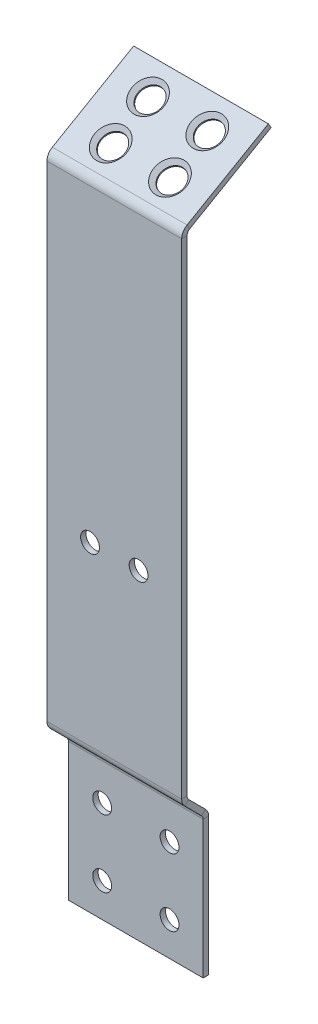
from build123d import *

# Parameters (mm, degrees)
SKETCH_1_W                            = 50
SKETCH_1_H                            = 245
SM_BASE_FLANGE_1_DEPTH                = 2
SM_START                              = -25
SM_EDGE_FLANGE_1_DEPTH                = 50
SM_EDGE_FLANGE_1_2_DEPTH              = 50
OTHER_START                           = -25
OTHER_1_DEPTH                         = 50
OTHER_1_2_DEPTH                       = 50
HOLE_WIZARD_M61_D                     = 9
HOLE_WIZARD_M61_CSINK_D               = 12
HOLE_WIZARD_M61_CSINK_ANGLE           = 90
HOLE_WIZARD_M61_ON_FACE_2_D           = 9
HOLE_WIZARD_M61_ON_FACE_2_CSINK_D     = 12
HOLE_WIZARD_M61_ON_FACE_2_CSINK_ANGLE = 90
HOLE_WIZARD_M61_ON_FACE_3_D           = 9
HOLE_WIZARD_M61_ON_FACE_3_CSINK_D     = 12
HOLE_WIZARD_M61_ON_FACE_3_CSINK_ANGLE = 90
SKETCH_9_R                            = 3.5
CUT_EXTRUDE_1_DEPTH                   = 2
SKETCH_10_R                           = 3.5
CUT_EXTRUDE_2_DEPTH                   = 2


# Read off the part's stored shape, not the designer's step: Ребро-кромка1, Изгиб1
# Sheet-metal steps are written as plain solids
with BuildPart() as part:
    # Sketch 1 → Базовая кромка1 (new body)
    with BuildSketch(Plane.XY):
        with Locations((0, 122.5)):
            Rectangle(SKETCH_1_W, SKETCH_1_H)
    extrude(amount=SM_BASE_FLANGE_1_DEPTH)

    # Ребро-кромка1 outline → Ребро-кромка1 (cut)
    with BuildSketch(Plane.YZ.offset(SM_START)):
        with BuildLine():
            ThreePointArc((241.535898385, 2), (243.535898385, 1.464101615), (245, 0))
            Line((245, 0), (245, 2))
            Line((245, 2), (241.535898385, 2))
        make_face()
    extrude(amount=SM_EDGE_FLANGE_1_DEPTH, mode=Mode.SUBTRACT)

    # Sm Edge Flange 1 2 outline → Sm Edge Flange 1 2 (add)
    with BuildSketch(Plane.YZ.offset(SM_START)):
        with BuildLine():
            Line((262.422649731, -30.176914536), (245, 0))
            Line((245, 0), (241.535898385, 0))
            ThreePointArc((241.535898385, 0), (242.535898385, -0.267949192), (243.267949192, -1))
            Line((243.267949192, -1), (260.690598923, -31.176914536))
            Line((260.690598923, -31.176914536), (262.422649731, -30.176914536))
        make_face()
    extrude(amount=SM_EDGE_FLANGE_1_2_DEPTH)

    # Other 1 outline → Other 1 (cut)
    with BuildSketch(Plane.YZ.offset(OTHER_START)):
        with BuildLine():
            Line((241.535898385, 2), (54.65685425, 2))
            Line((54.65685425, 2), (53.82842715, 1.17157285))
            ThreePointArc((53.82842715, 1.17157285), (52.530733743, 0.304481837), (51, -3.6e-08))
            Line((51, -3.6e-08), (241.535898385, 0))
            ThreePointArc((241.535898385, 0), (242.535898385, -0.267949192), (243.267949192, -1))
            Line((243.267949192, -1), (260.690598923, -31.176914536))
            Line((260.690598923, -31.176914536), (262.422649731, -30.176914536))
            Line((262.422649731, -30.176914536), (245, 0))
            ThreePointArc((245, 0), (243.535898385, 1.464101615), (241.535898385, 2))
        make_face()
    extrude(amount=OTHER_1_DEPTH, mode=Mode.SUBTRACT)

    # Other 1 2 outline → Other 1 2 (add)
    with BuildSketch(Plane.YZ.offset(OTHER_START)):
        with BuildLine():
            Line((241.535898385, 10), (61.485281398, 10.000000033))
            ThreePointArc((61.485281398, 10.000000033), (59.954547643, 9.695518165), (58.656854226, 8.828427148))
            Line((58.656854226, 8.828427148), (52.414213588, 2.585786412))
            ThreePointArc((52.414213588, 2.585786412), (51.765366878, 2.152240902), (51, 1.999999964))
            Line((51, 1.999999964), (54.65685425, 2))
            Line((54.65685425, 2), (60.071067788, 7.414213586))
            ThreePointArc((60.071067788, 7.414213586), (60.719914496, 7.847759096), (61.485281374, 8.000000033))
            Line((61.485281374, 8.000000033), (241.535898385, 8))
            ThreePointArc((241.535898385, 8), (242.535898385, 7.732050808), (243.267949192, 7))
            Line((243.267949192, 7), (260.690598923, -23.176914536))
            Line((260.690598923, -23.176914536), (262.422649731, -22.176914536))
            Line((262.422649731, -22.176914536), (245, 8))
            ThreePointArc((245, 8), (243.535898385, 9.464101615), (241.535898385, 10))
        make_face()
    extrude(amount=OTHER_1_2_DEPTH)

    # Зенковка для винта с потайной головкой M61 (through all)
    with Locations(Plane(origin=(-11, 257.422649731, -13.516660498), x_dir=(0, -0.5, 0.866025403784), z_dir=(0, 0.866025403784, 0.5))):
        with Locations((0, 0)):
            CounterSinkHole(HOLE_WIZARD_M61_D / 2, HOLE_WIZARD_M61_CSINK_D / 2, counter_sink_angle=HOLE_WIZARD_M61_CSINK_ANGLE)

    # Зенковка для винта с потайной головкой M61 on face 2 (through all)
    with Locations(Plane(origin=(11, 257.422649731, -13.516660498), x_dir=(0, -0.500000174844, 0.866025302838), z_dir=(0, 0.866025302838, 0.500000174844))):
        with Locations((0, 0)):
            CounterSinkHole(HOLE_WIZARD_M61_ON_FACE_2_D / 2, HOLE_WIZARD_M61_ON_FACE_2_CSINK_D / 2, counter_sink_angle=HOLE_WIZARD_M61_ON_FACE_2_CSINK_ANGLE)

    # Зенковка для винта с потайной головкой M61 on face 3 (through all)
    with Locations(Plane(origin=(11, 249.422649731, 0.339745962), x_dir=(0, -0.500000174844, 0.866025302838), z_dir=(0, 0.866025302838, 0.500000174844))):
        with Locations((0, 0), (0, -22)):
            CounterSinkHole(HOLE_WIZARD_M61_ON_FACE_3_D / 2, HOLE_WIZARD_M61_ON_FACE_3_CSINK_D / 2, counter_sink_angle=HOLE_WIZARD_M61_ON_FACE_3_CSINK_ANGLE)

    # Эскиз9 → Вытянуть1 (cut)
    with BuildSketch(Plane.XY.offset(2)):
        with Locations((-12.5, 37.5)):
            Circle(SKETCH_9_R)
        with Locations((-12.5, 12.5)):
            Circle(SKETCH_9_R)
        with Locations((12.5, 12.5)):
            Circle(SKETCH_9_R)
        with Locations((12.5, 37.5)):
            Circle(SKETCH_9_R)
    extrude(amount=-CUT_EXTRUDE_1_DEPTH, mode=Mode.SUBTRACT)

    # Эскиз10 → Вытянуть2 (cut)
    with BuildSketch(Plane.XY.offset(10)):
        with Locations((-9, 127)):
            Circle(SKETCH_10_R)
        with Locations((9, 127)):
            Circle(SKETCH_10_R)
    extrude(amount=-CUT_EXTRUDE_2_DEPTH, mode=Mode.SUBTRACT)


solid = part.part
